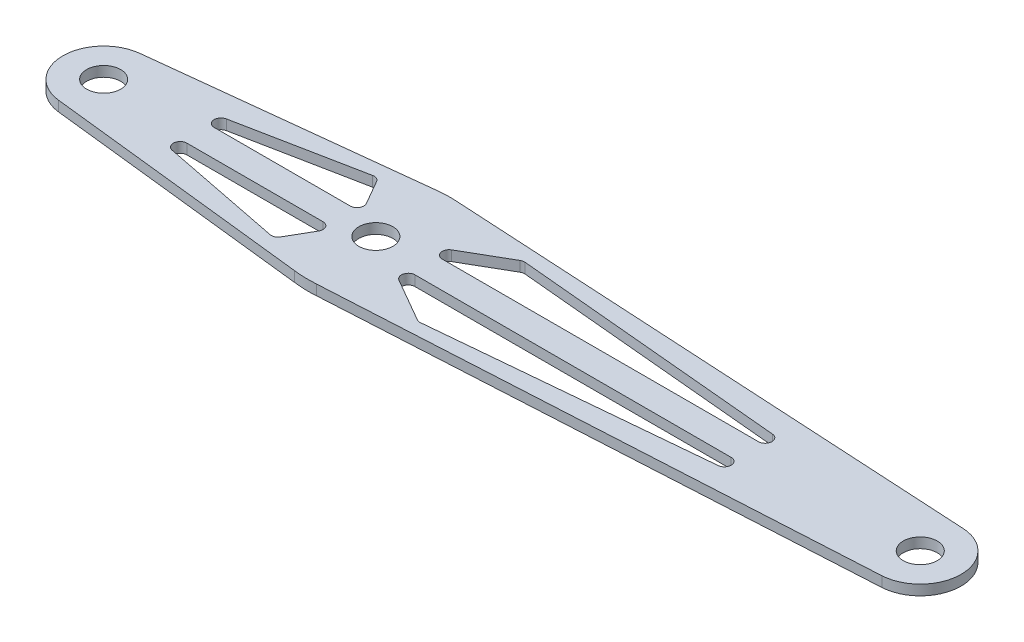
from build123d import *

# Parameters (mm, degrees)
SKETCH_1_R          = 5
EXTRUDE_1_DEPTH     = 3
CUT_EXTRUDE_1_DEPTH = 3
FILLET_2_R          = 2


with BuildPart() as part:
    # 草图1 → 凸台-拉伸1 (new body)
    with BuildSketch(Plane(origin=(0, 0, 0), x_dir=(1, 0, 0), z_dir=(0, 1, 0))):
        with BuildLine():
            Line((-1.330576007, 11.926003836), (80, 21))
            Line((80, 21), (240.672524597, 11.98113979))
            ThreePointArc((240.672524597, 11.98113979), (252, 0), (240.672524597, -11.98113979))
            Line((240.672524597, -11.98113979), (80, -21))
            Line((80, -21), (-1.330576007, -11.926003836))
            ThreePointArc((-1.330576007, -11.926003836), (-12, 0), (-1.330576007, 11.926003836))
        make_face()
        with Locations(Location((0, 0, 0), (0, 0, 270))):
            Circle(SKETCH_1_R, mode=Mode.SUBTRACT)
        with Locations(Location((80, 0, 0), (0, 0, 270))):
            Circle(SKETCH_1_R, mode=Mode.SUBTRACT)
        with Locations(Location((240, 0, 0), (0, 0, 270))):
            Circle(SKETCH_1_R, mode=Mode.SUBTRACT)
    extrude(amount=EXTRUDE_1_DEPTH)

    # 圆角1
    # a fillet whose section is not a circle: 40 mm, written as the material it takes off along each edge
    with BuildSketch(Plane(origin=(80, -8.378669722, 21), x_dir=(0.9984283158275346, 0, -0.0560437164523641), z_dir=(0, 1, 0)), Plane(origin=(80, -8.378669722, -21), x_dir=(-0.9938336529777407, 0, 0.1108813339066567), z_dir=(0, 1, 0))) as fillet_1_piece_1:
        with BuildLine():
            add(Edge.make_bspline([(3.351467889, 0), (2.723727072, 0), (2.095986256, 0), (0.700623386, 0.02340826), (-0.686959659, 0.139669261), (-2.06676288, 0.348783001), (-2.685751394, 0.453242334), (-3.304739908, 0.557701667)], knots=[0, 0, 0, 0, 0, 0, 0.5, 0.5, 1, 1, 1, 1, 1, 1], degree=5))
            Line((-3.304739908, 0.557701667), (0, 0))
            Line((0, 0), (3.351467889, 0))
        make_face()
    extrude(amount=19.757339444, mode=Mode.SUBTRACT)

    # 草图2 → 切除-拉伸1 (cut)
    with BuildSketch(Plane.XZ):
        Polygon((8.062257748, 4), (65.387758913, 15.344903932), (71.937742252, 4), align=None)
        Polygon((88.062257748, 4), (107.859425007, 15.429899846), (231.937742252, 4), align=None)
        Polygon((107.859425007, -15.429899846), (231.937742252, -4), (88.062257748, -4), align=None)
        Polygon((65.387758913, -15.344903932), (71.937742252, -4), (8.062257748, -4), align=None)
    extrude(amount=-CUT_EXTRUDE_1_DEPTH, mode=Mode.SUBTRACT)

    # 圆角2
    fillet_2_edges = [part.edges().sort_by_distance(p)[0] for p in [
        (65.387758913, 1.5, -15.344903932),
        (8.062257748, 1.5, -4),
        (71.937742252, 1.5, -4),
        (107.859425007, 1.5, -15.429899846),
        (88.062257748, 1.5, -4),
        (231.937742252, 1.5, -4),
        (231.937742252, 1.5, 4),
        (88.062257748, 1.5, 4),
        (107.859425007, 1.5, 15.429899846),
        (71.937742252, 1.5, 4),
        (8.062257748, 1.5, 4),
        (65.387758913, 1.5, 15.344903932),
    ]]
    fillet(fillet_2_edges, radius=FILLET_2_R)


solid = part.part
